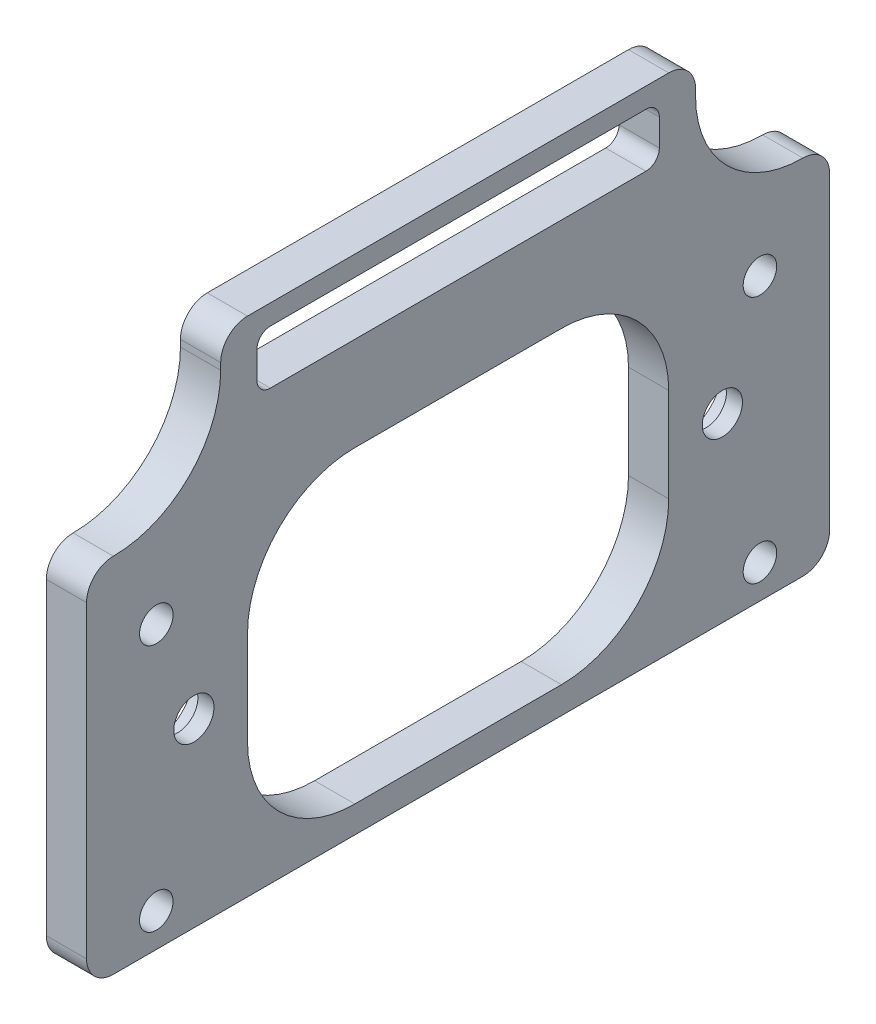
from build123d import *

# Parameters (mm, degrees)
SKETCH_1_W             = 55.4
SKETCH_1_H             = 37.5
SKETCH_1_W_2           = 30
SKETCH_1_H_2           = 4
EXTRUDE_1_DEPTH        = 3
SKETCH_2_R             = 1.25
CUT_EXTRUDE_1_DEPTH    = 67.965737508
SKETCH_3_W             = 10
SKETCH_3_H             = 10.5
CUT_EXTRUDE_2_DEPTH    = 67.965737508
FILLET_2_R             = 1
FILLET_3_R             = 2
SKETCH_6_R             = 1.5
CUT_EXTRUDE_4_DEPTH    = 67.965737508
SKETCH_7_R             = 3
CUT_EXTRUDE_5_DEPTH    = 1.8
FILLET_4_R             = 8
SKETCH_10_W            = 31.4
SKETCH_10_H            = 23
CUT_EXTRUDE_6_DEPTH    = 10
FILLET_5_R             = 8
FILLET_6_R             = 2
HOLE_WIZARD_M3_1_D     = 2.5
HOLE_WIZARD_M3_1_DEPTH = 3
HOLE_WIZARD_M3_1_TIP   = 0.751075774


with BuildPart() as part:
    # 草图1 → 凸台-拉伸1 (new body)
    with BuildSketch(Plane(origin=(0, 0, 0), x_dir=(0, 0, -1), z_dir=(1, 0, 0))):
        with Locations((27.7, 18.75)):
            Rectangle(SKETCH_1_W, SKETCH_1_H)
        with Locations((27.7, 34)):
            Rectangle(SKETCH_1_W_2, SKETCH_1_H_2, mode=Mode.SUBTRACT)
    extrude(amount=EXTRUDE_1_DEPTH)

    # 草图2 → 切除-拉伸1 (cut, through all)
    with BuildSketch(Plane(origin=(3, 0, 0), x_dir=(0, 0, -1), z_dir=(1, 0, 0))):
        with Locations((5.2, 21)):
            Circle(SKETCH_2_R)
        with Locations((5.2, 2.5)):
            Circle(SKETCH_2_R)
        with Locations((50.2, 21)):
            Circle(SKETCH_2_R)
        with Locations((50.2, 2.5)):
            Circle(SKETCH_2_R)
    extrude(amount=-CUT_EXTRUDE_1_DEPTH, mode=Mode.SUBTRACT)

    # 草图3 → 切除-拉伸2 (cut, through all)
    with BuildSketch(Plane(origin=(3, 0, 0), x_dir=(0, 0, -1), z_dir=(1, 0, 0))):
        with Locations((5, 32.25)):
            Rectangle(SKETCH_3_W, SKETCH_3_H)
        with Locations((50.4, 32.25)):
            Rectangle(SKETCH_3_W, SKETCH_3_H)
    extrude(amount=-CUT_EXTRUDE_2_DEPTH, mode=Mode.SUBTRACT)

    # 圆角2
    fillet_2_edges = [part.edges().sort_by_distance(p)[0] for p in [
        (1.5, 36, -12.7),
        (1.5, 32, -12.7),
        (1.5, 32, -42.7),
        (1.5, 36, -42.7),
    ]]
    fillet(fillet_2_edges, radius=FILLET_2_R)

    # 圆角3
    fillet_3_edges = [part.edges().sort_by_distance(p)[0] for p in [
        (1.5, 37.5, -10),
        (1.5, 37.5, -45.4),
    ]]
    fillet(fillet_3_edges, radius=FILLET_3_R)

    # 草图6 → 切除-拉伸4 (cut, through all)
    with BuildSketch(Plane.ZY):
        with Locations((-47.4, 13.5)):
            Circle(SKETCH_6_R)
        with Locations((-8, 13.5)):
            Circle(SKETCH_6_R)
    extrude(amount=-CUT_EXTRUDE_4_DEPTH, mode=Mode.SUBTRACT)

    # 草图7 → 切除-拉伸5 (cut)
    with BuildSketch(Plane.ZY):
        with Locations((-47.4, 13.5)):
            Circle(SKETCH_7_R)
        with Locations((-8, 13.5)):
            Circle(SKETCH_7_R)
    extrude(amount=-CUT_EXTRUDE_5_DEPTH, mode=Mode.SUBTRACT)

    # 圆角4
    fillet_4_edges = [part.edges().sort_by_distance(p)[0] for p in [
        (1.5, 27, -10),
        (1.5, 27, -45.4),
    ]]
    fillet(fillet_4_edges, radius=FILLET_4_R)

    # 草图10 → 切除-拉伸6 (cut)
    with BuildSketch(Plane.ZY):
        with Locations((-27.7, 13.5)):
            Rectangle(SKETCH_10_W, SKETCH_10_H)
    extrude(amount=-CUT_EXTRUDE_6_DEPTH, mode=Mode.SUBTRACT)

    # 圆角5
    fillet_5_edges = [part.edges().sort_by_distance(p)[0] for p in [
        (1.5, 25, -12),
        (1.5, 2, -12),
        (1.5, 2, -43.4),
        (1.5, 25, -43.4),
    ]]
    fillet(fillet_5_edges, radius=FILLET_5_R)

    # 圆角6
    fillet_6_edges = [part.edges().sort_by_distance(p)[0] for p in [
        (1.5, 27, -55.4),
        (1.5, 0, -55.4),
        (1.5, 0, 0),
        (1.5, 27, 0),
    ]]
    fillet(fillet_6_edges, radius=FILLET_6_R - 0.0001)  # a hair under: the kernel refuses the full size

    # M3 螺纹孔1
    with Locations(Plane(origin=(0, 21, -50.2), x_dir=(0, 0, -1), z_dir=(-1, 0, 0))):
        with Locations((0, 0), (0, 18.5), (-45, 18.5), (-45, 0)):
            Hole(HOLE_WIZARD_M3_1_D / 2, depth=HOLE_WIZARD_M3_1_DEPTH)
            with Locations((0, 0, -(HOLE_WIZARD_M3_1_DEPTH + HOLE_WIZARD_M3_1_TIP / 2))):  # 118° drill point
                Cone(0, HOLE_WIZARD_M3_1_D / 2, HOLE_WIZARD_M3_1_TIP, mode=Mode.SUBTRACT)


solid = part.part
